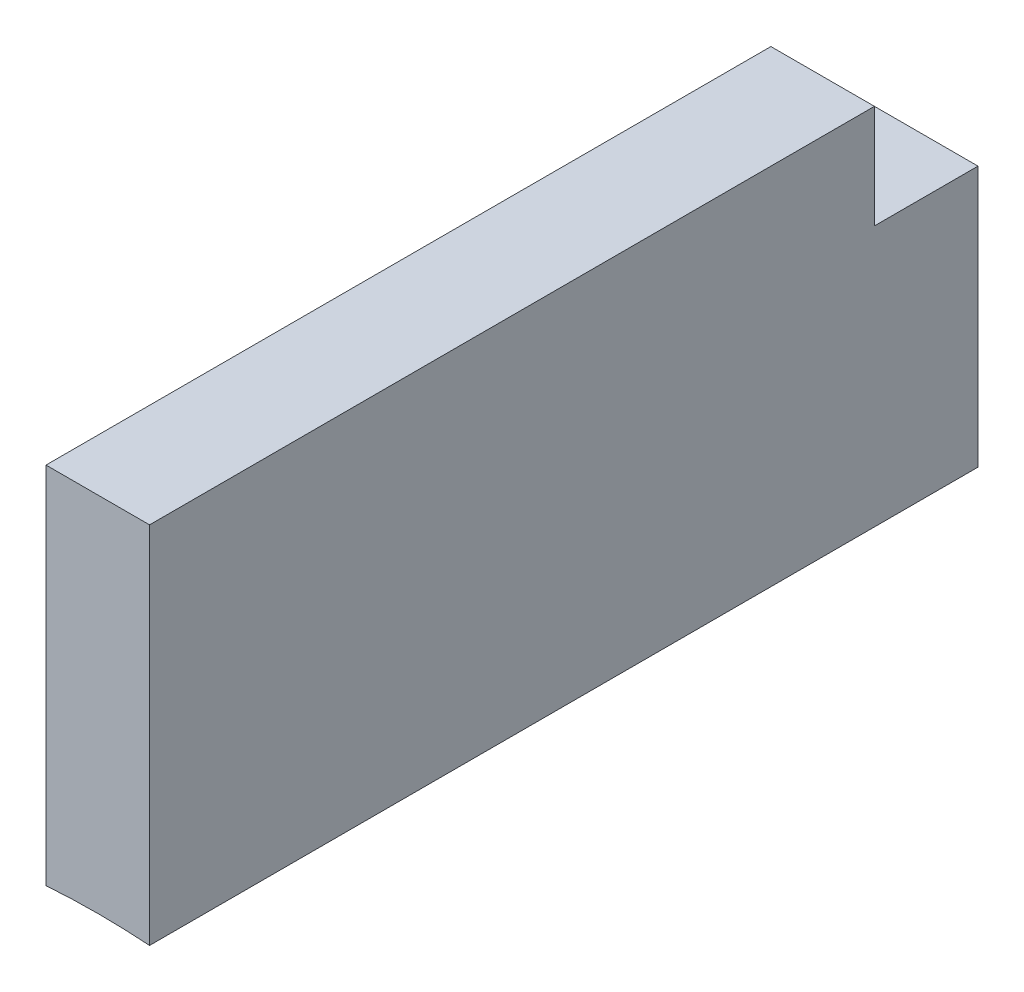
from build123d import *

# Parameters (mm, degrees)
BOSS_EXTRUDE1_DEPTH = 40
SKETCH2_W           = 5
SKETCH2_H           = 5
CUT_EXTRUDE1_DEPTH  = 10


# Read off the part's stored shape, not the designer's step: Boss-Extrude1
with BuildPart() as part:
    # Boss-Extrude1 outline → Boss-Extrude1 (new body)
    with BuildSketch(Plane.XY):
        with BuildLine():
            Line((-5, 0), (-5, -17.588137581))
            ThreePointArc((-5, -17.588137581), (-2.5, -17.5), (0, -17.588137581))
            Line((0, -17.588137581), (0, 0))
            Line((0, 0), (-5, 0))
        make_face()
    extrude(amount=BOSS_EXTRUDE1_DEPTH)

    # Sketch2 → Cut-Extrude1 (cut)
    with BuildSketch(Plane(origin=(0, 0, 0), x_dir=(0, 0, -1), z_dir=(1, 0, 0))):
        with Locations((-2.5, -2.5)):
            Rectangle(SKETCH2_W, SKETCH2_H)
        with Locations((-17.5, 17.5)):
            Rectangle(SKETCH2_W, SKETCH2_H)
    extrude(amount=-CUT_EXTRUDE1_DEPTH, mode=Mode.SUBTRACT)


solid = part.part
